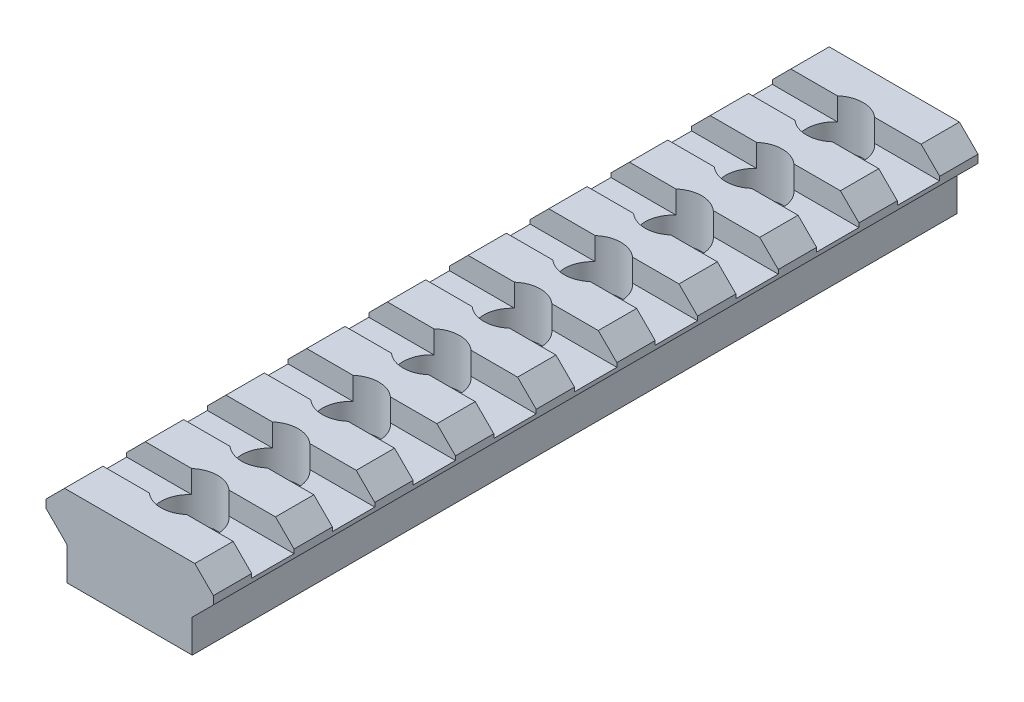
from build123d import *

# Parameters (mm, degrees)
DODANIE_WYCI_GNI_CIE2_DEPTH     = 94.75
SZKIC2_W                        = 21.74
SZKIC2_H                        = 5.25
WYTNIJ_WYCI_GNI_CIE2_DEPTH      = 2.8
SZKIC3_R                        = 1.75
WYTNIJ_WYCI_GNI_CIE3_DEPTH      = 98.478357085
WYTNIJ_WYCI_GNI_CIE4_DEPTH      = 3.2
WYTNIJ_WYCI_GNI_CIE4_DEPTH_BACK = 100.287258498
SZKIC4_R                        = 3.5
CUT_EXTRUDE1_DEPTH              = 98.478357085


with BuildPart() as part:
    # Szkic1 → Dodanie-wyciągnięcie2 (new body)
    with BuildSketch(Plane.XY):
        Polygon((2.8, 2.8), (0, 0), (3.12, -3.12), (3.12, -7.2), (18.62, -7.2), (18.62, -3.12), (21.74, 0), (18.94, 2.8), align=None)
    extrude(amount=DODANIE_WYCI_GNI_CIE2_DEPTH)

    # Szkic2 → Wytnij-wyciągnięcie2 (cut)
    with BuildSketch(Plane(origin=(0, 2.8, 0), x_dir=(1, 0, 0), z_dir=(0, 1, 0))):
        with Locations((10.87, -17.375)):
            Rectangle(SZKIC2_W, SZKIC2_H)
        with Locations((10.87, -7.375)):
            Rectangle(SZKIC2_W, SZKIC2_H)
        with Locations((10.87, -27.375)):
            Rectangle(SZKIC2_W, SZKIC2_H)
        with Locations((10.87, -37.375)):
            Rectangle(SZKIC2_W, SZKIC2_H)
        with Locations((10.87, -47.375)):
            Rectangle(SZKIC2_W, SZKIC2_H)
        with Locations((10.87, -57.375)):
            Rectangle(SZKIC2_W, SZKIC2_H)
        with Locations((10.87, -67.375)):
            Rectangle(SZKIC2_W, SZKIC2_H)
        with Locations((10.87, -77.375)):
            Rectangle(SZKIC2_W, SZKIC2_H)
        with Locations((10.87, -87.375)):
            Rectangle(SZKIC2_W, SZKIC2_H)
    extrude(amount=-WYTNIJ_WYCI_GNI_CIE2_DEPTH, mode=Mode.SUBTRACT)

    # Szkic3 → Wytnij-wyciągnięcie3 (cut, through all)
    with BuildSketch(Plane(origin=(0, 0, 0), x_dir=(1, 0, 0), z_dir=(0, 1, 0))):
        with Locations((10.87, -7.375)):
            Circle(SZKIC3_R)
        with Locations((10.87, -17.375)):
            Circle(SZKIC3_R)
        with Locations((10.87, -27.375)):
            Circle(SZKIC3_R)
        with Locations((10.87, -37.375)):
            Circle(SZKIC3_R)
        with Locations((10.87, -47.375)):
            Circle(SZKIC3_R)
        with Locations((10.87, -57.375)):
            Circle(SZKIC3_R)
        with Locations((10.87, -67.375)):
            Circle(SZKIC3_R)
        with Locations((10.87, -77.375)):
            Circle(SZKIC3_R)
        with Locations((10.87, -87.375)):
            Circle(SZKIC3_R)
    extrude(amount=-WYTNIJ_WYCI_GNI_CIE3_DEPTH, mode=Mode.SUBTRACT)

    # Szkic4 → Wytnij-wyciągnięcie4 (cut, two sides: drawn at the far end of the back side and taken through both)
    with BuildSketch(Plane(origin=(0, 0, -1.86), x_dir=(1, 0, 0), z_dir=(0, -1, 0)).offset(-WYTNIJ_WYCI_GNI_CIE4_DEPTH_BACK)):
        with Locations((10.87, 89.235)):
            Circle(SZKIC4_R)
        with Locations((10.87, 79.235)):
            Circle(SZKIC4_R)
        with Locations((10.87, 69.235)):
            Circle(SZKIC4_R)
        with Locations((10.87, 59.235)):
            Circle(SZKIC4_R)
        with Locations((10.87, 49.235)):
            Circle(SZKIC4_R)
        with Locations((10.87, 39.235)):
            Circle(SZKIC4_R)
        with Locations((10.87, 29.235)):
            Circle(SZKIC4_R)
        with Locations((10.87, 19.235)):
            Circle(SZKIC4_R)
        with Locations((10.87, 9.235)):
            Circle(SZKIC4_R)
    extrude(amount=WYTNIJ_WYCI_GNI_CIE4_DEPTH + WYTNIJ_WYCI_GNI_CIE4_DEPTH_BACK, mode=Mode.SUBTRACT)

    # Sketch1 → Cut-Extrude1 (cut, through all)
    with BuildSketch(Plane.XY.offset(94.75)):
        Polygon((0.5, 0.5), (0.5, -0.5), (0, 0), align=None)
        Polygon((21.74, 0), (21.24, -0.5), (21.24, 0.5), align=None)
    extrude(amount=-CUT_EXTRUDE1_DEPTH, mode=Mode.SUBTRACT)


solid = part.part
